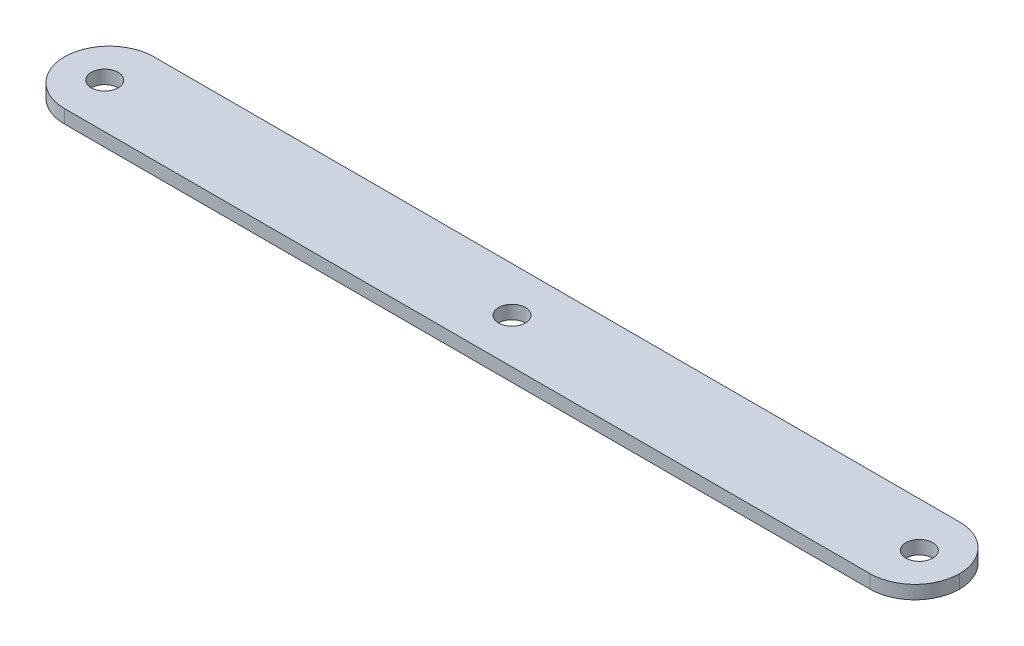
from build123d import *

# Parameters (mm, degrees)
SKETCH2_W           = 200
SKETCH2_H           = 20
BOSS_EXTRUDE1_DEPTH = 3
SKETCH3_R           = 3
CUT_EXTRUDE1_DEPTH  = 202.019899512
SKETCH4_R           = 3
CUT_EXTRUDE2_DEPTH  = 202.019899512
FILLET1_R           = 10
FILLET2_R           = 10
SKETCH6_R           = 3
CUT_EXTRUDE3_DEPTH  = 202.019899512


with BuildPart() as part:
    # Sketch2 → Boss-Extrude1 (new body)
    with BuildSketch(Plane(origin=(0, 0, 0), x_dir=(1, 0, 0), z_dir=(0, 1, 0))):
        with Locations((100, 10)):
            Rectangle(SKETCH2_W, SKETCH2_H)
    extrude(amount=BOSS_EXTRUDE1_DEPTH)

    # Sketch3 → Cut-Extrude1 (cut, through all)
    with BuildSketch(Plane(origin=(0, 3, 0), x_dir=(1, 0, 0), z_dir=(0, 1, 0))):
        with Locations(Location((9, 10, 0), (0, 0, 270))):
            Circle(SKETCH3_R)
    extrude(amount=-CUT_EXTRUDE1_DEPTH, mode=Mode.SUBTRACT)

    # Sketch4 → Cut-Extrude2 (cut, through all)
    with BuildSketch(Plane(origin=(0, 3, 0), x_dir=(1, 0, 0), z_dir=(0, 1, 0))):
        with Locations(Location((191, 10, 0), (0, 0, 270))):
            Circle(SKETCH4_R)
    extrude(amount=-CUT_EXTRUDE2_DEPTH, mode=Mode.SUBTRACT)

    # Fillet1
    fillet1_edges = [part.edges().sort_by_distance(p)[0] for p in [
        (0, 1.5, -20),
        (0, 1.5, 0),
    ]]
    fillet(fillet1_edges, radius=FILLET1_R - 0.0001)  # a hair under: the kernel refuses the full size

    # Fillet2
    fillet2_edges = [part.edges().sort_by_distance(p)[0] for p in [
        (200, 1.5, -20),
        (200, 1.5, 0),
    ]]
    fillet(fillet2_edges, radius=FILLET2_R - 0.0001)  # a hair under: the kernel refuses the full size

    # Sketch6 → Cut-Extrude3 (cut, through all)
    with BuildSketch(Plane(origin=(0, 3, 0), x_dir=(1, 0, 0), z_dir=(0, 1, 0))):
        with Locations(Location((100, 10, 0), (0, 0, 270))):
            Circle(SKETCH6_R)
    extrude(amount=-CUT_EXTRUDE3_DEPTH, mode=Mode.SUBTRACT)


solid = part.part
